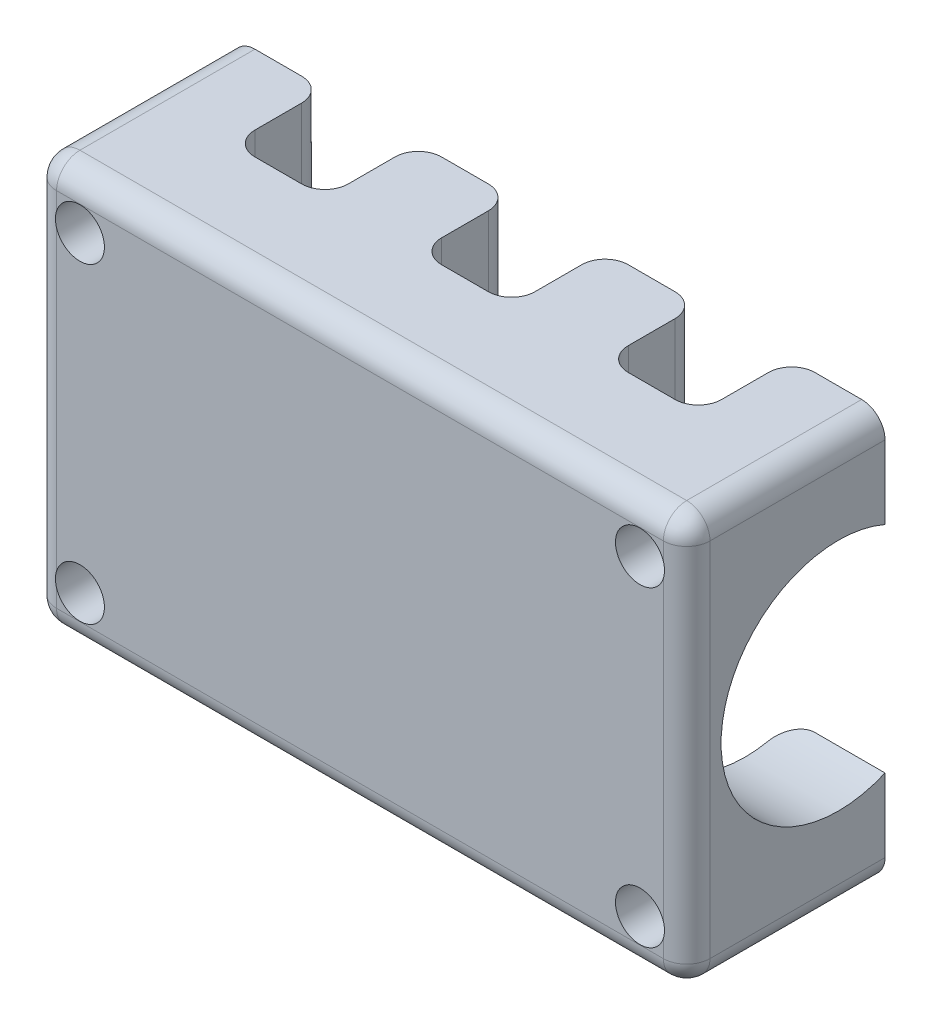
from build123d import *

# Parameters (mm, degrees)
SKETCH_1_W          = 56
SKETCH_1_H          = 35
EXTRUDE_1_DEPTH     = 26
SKETCH_2_R          = 10.05
CUT_EXTRUDE_1_DEPTH = 63
CUT_EXTRUDE_4_DEPTH = 41
SKETCH_6_R          = 2.1
CUT_EXTRUDE_5_DEPTH = 41
FILLET_2_R          = 2
FILLET_3_R          = 2


with BuildPart() as part:
    # 草图1 → 凸台-拉伸1 (new body)
    with BuildSketch(Plane.XY):
        with Locations((28, -17.5)):
            Rectangle(SKETCH_1_W, SKETCH_1_H)
    extrude(amount=EXTRUDE_1_DEPTH)

    # 草图2 → 切除-拉伸1 (cut)
    with BuildSketch(Plane.ZY):
        with Locations(Location((13, -17.5, 0), (0, 0, 270))):
            Circle(SKETCH_2_R)
    extrude(amount=-CUT_EXTRUDE_1_DEPTH, mode=Mode.SUBTRACT)

    # 草图3 → 切除-拉伸4 (cut)
    with BuildSketch(Plane(origin=(0, 0, 0), x_dir=(1, 0, 0), z_dir=(0, 1, 0))):
        Polygon((0, 0), (0, -9), (8, -9), (8, -17), (16, -17), (16, -9), (24, -9), (24, -17), (32, -17), (32, -9), (40, -9), (40, -17), (48, -17), (48, -9), (56, -9), (56, 0), align=None)
    extrude(amount=-CUT_EXTRUDE_4_DEPTH, mode=Mode.SUBTRACT)

    # 草图6 → 切除-拉伸5 (cut)
    with BuildSketch(Plane.XY.offset(26)):
        with Locations((4, -4.140159981)):
            Circle(SKETCH_6_R)
        with Locations((52, -4.140159981)):
            Circle(SKETCH_6_R)
        with Locations((52, -30.859840019)):
            Circle(SKETCH_6_R)
        with Locations((4, -30.859840019)):
            Circle(SKETCH_6_R)
    extrude(amount=-CUT_EXTRUDE_5_DEPTH, mode=Mode.SUBTRACT)

    # 圆角2
    # the kernel refuses this fillet: 2 mm, written as the material it adds along each edge
    with BuildSketch(Plane(origin=(48, -21.719680038, 17), x_dir=(-1, 0, 0), z_dir=(0, -1, 0))) as fillet_2_piece_1_section:
        with BuildLine():
            CenterArc((FILLET_2_R, FILLET_2_R), FILLET_2_R, 180, 90)
            Line((0, FILLET_2_R), (0, 0))
            Line((0, 0), (FILLET_2_R, 0))
        make_face()
    fillet_2_piece_1 = extrude(amount=13.280319962, mode=Mode.PRIVATE)
    fillet_2_piece_1 = fillet_2_piece_1 - Plane(origin=(47.542308917, -17.5, 13), x_dir=(0, -1, 0), z_dir=(-1, 0, 0)) * Cylinder(10.05, 35, mode=Mode.PRIVATE)
    add(fillet_2_piece_1)
    with BuildSketch(Plane(origin=(48, 0, 17), x_dir=(-1, 0, 0), z_dir=(0, -1, 0))) as fillet_2_piece_2_section:
        with BuildLine():
            CenterArc((FILLET_2_R, FILLET_2_R), FILLET_2_R, 180, 90)
            Line((0, FILLET_2_R), (0, 0))
            Line((0, 0), (FILLET_2_R, 0))
        make_face()
    fillet_2_piece_2 = extrude(amount=13.280319962, mode=Mode.PRIVATE)
    fillet_2_piece_2 = fillet_2_piece_2 - Plane(origin=(47.542307567, -17.5, 13), x_dir=(0, -1, 0), z_dir=(-1, 0, 0)) * Cylinder(10.05, 35, mode=Mode.PRIVATE)
    add(fillet_2_piece_2)
    with BuildSketch(Plane(origin=(40, -21.719680038, 17), x_dir=(0, 0, -1), z_dir=(0, -1, 0))) as fillet_2_piece_3_section:
        with BuildLine():
            CenterArc((FILLET_2_R, FILLET_2_R), FILLET_2_R, 180, 90)
            Line((0, FILLET_2_R), (0, 0))
            Line((0, 0), (FILLET_2_R, 0))
        make_face()
    fillet_2_piece_3 = extrude(amount=13.280319962, mode=Mode.PRIVATE)
    fillet_2_piece_3 = fillet_2_piece_3 - Plane(origin=(40.457691176, -17.5, 13), x_dir=(0, -1, 0), z_dir=(-1, 0, 0)) * Cylinder(10.05, 35, mode=Mode.PRIVATE)
    add(fillet_2_piece_3)
    with BuildSketch(Plane(origin=(40, 0, 17), x_dir=(0, 0, -1), z_dir=(0, -1, 0))) as fillet_2_piece_4_section:
        with BuildLine():
            CenterArc((FILLET_2_R, FILLET_2_R), FILLET_2_R, 180, 90)
            Line((0, FILLET_2_R), (0, 0))
            Line((0, 0), (FILLET_2_R, 0))
        make_face()
    fillet_2_piece_4 = extrude(amount=13.280319962, mode=Mode.PRIVATE)
    fillet_2_piece_4 = fillet_2_piece_4 - Plane(origin=(40.457692526, -17.5, 13), x_dir=(0, -1, 0), z_dir=(-1, 0, 0)) * Cylinder(10.05, 35, mode=Mode.PRIVATE)
    add(fillet_2_piece_4)
    with BuildSketch(Plane(origin=(32, -21.719680038, 17), x_dir=(-1, 0, 0), z_dir=(0, -1, 0))) as fillet_2_piece_5_section:
        with BuildLine():
            CenterArc((FILLET_2_R, FILLET_2_R), FILLET_2_R, 180, 90)
            Line((0, FILLET_2_R), (0, 0))
            Line((0, 0), (FILLET_2_R, 0))
        make_face()
    fillet_2_piece_5 = extrude(amount=13.280319962, mode=Mode.PRIVATE)
    fillet_2_piece_5 = fillet_2_piece_5 - Plane(origin=(31.542308917, -17.5, 13), x_dir=(0, -1, 0), z_dir=(-1, 0, 0)) * Cylinder(10.05, 35, mode=Mode.PRIVATE)
    add(fillet_2_piece_5)
    with BuildSketch(Plane(origin=(32, 0, 17), x_dir=(-1, 0, 0), z_dir=(0, -1, 0))) as fillet_2_piece_6_section:
        with BuildLine():
            CenterArc((FILLET_2_R, FILLET_2_R), FILLET_2_R, 180, 90)
            Line((0, FILLET_2_R), (0, 0))
            Line((0, 0), (FILLET_2_R, 0))
        make_face()
    fillet_2_piece_6 = extrude(amount=13.280319962, mode=Mode.PRIVATE)
    fillet_2_piece_6 = fillet_2_piece_6 - Plane(origin=(31.542307567, -17.5, 13), x_dir=(0, -1, 0), z_dir=(-1, 0, 0)) * Cylinder(10.05, 35, mode=Mode.PRIVATE)
    add(fillet_2_piece_6)
    with BuildSketch(Plane(origin=(24, -21.719680038, 17), x_dir=(0, 0, -1), z_dir=(0, -1, 0))) as fillet_2_piece_7_section:
        with BuildLine():
            CenterArc((FILLET_2_R, FILLET_2_R), FILLET_2_R, 180, 90)
            Line((0, FILLET_2_R), (0, 0))
            Line((0, 0), (FILLET_2_R, 0))
        make_face()
    fillet_2_piece_7 = extrude(amount=13.280319962, mode=Mode.PRIVATE)
    fillet_2_piece_7 = fillet_2_piece_7 - Plane(origin=(24.457691176, -17.5, 13), x_dir=(0, -1, 0), z_dir=(-1, 0, 0)) * Cylinder(10.05, 35, mode=Mode.PRIVATE)
    add(fillet_2_piece_7)
    with BuildSketch(Plane(origin=(24, 0, 17), x_dir=(0, 0, -1), z_dir=(0, -1, 0))) as fillet_2_piece_8_section:
        with BuildLine():
            CenterArc((FILLET_2_R, FILLET_2_R), FILLET_2_R, 180, 90)
            Line((0, FILLET_2_R), (0, 0))
            Line((0, 0), (FILLET_2_R, 0))
        make_face()
    fillet_2_piece_8 = extrude(amount=13.280319962, mode=Mode.PRIVATE)
    fillet_2_piece_8 = fillet_2_piece_8 - Plane(origin=(24.457692526, -17.5, 13), x_dir=(0, -1, 0), z_dir=(-1, 0, 0)) * Cylinder(10.05, 35, mode=Mode.PRIVATE)
    add(fillet_2_piece_8)
    with BuildSketch(Plane(origin=(16, -21.719680038, 17), x_dir=(-1, 0, 0), z_dir=(0, -1, 0))) as fillet_2_piece_9_section:
        with BuildLine():
            CenterArc((FILLET_2_R, FILLET_2_R), FILLET_2_R, 180, 90)
            Line((0, FILLET_2_R), (0, 0))
            Line((0, 0), (FILLET_2_R, 0))
        make_face()
    fillet_2_piece_9 = extrude(amount=13.280319962, mode=Mode.PRIVATE)
    fillet_2_piece_9 = fillet_2_piece_9 - Plane(origin=(15.542308917, -17.5, 13), x_dir=(0, -1, 0), z_dir=(-1, 0, 0)) * Cylinder(10.05, 35, mode=Mode.PRIVATE)
    add(fillet_2_piece_9)
    with BuildSketch(Plane(origin=(16, 0, 17), x_dir=(-1, 0, 0), z_dir=(0, -1, 0))) as fillet_2_piece_10_section:
        with BuildLine():
            CenterArc((FILLET_2_R, FILLET_2_R), FILLET_2_R, 180, 90)
            Line((0, FILLET_2_R), (0, 0))
            Line((0, 0), (FILLET_2_R, 0))
        make_face()
    fillet_2_piece_10 = extrude(amount=13.280319962, mode=Mode.PRIVATE)
    fillet_2_piece_10 = fillet_2_piece_10 - Plane(origin=(15.542307567, -17.5, 13), x_dir=(0, -1, 0), z_dir=(-1, 0, 0)) * Cylinder(10.05, 35, mode=Mode.PRIVATE)
    add(fillet_2_piece_10)
    with BuildSketch(Plane(origin=(8, -21.719680038, 17), x_dir=(0, 0, -1), z_dir=(0, -1, 0))) as fillet_2_piece_11_section:
        with BuildLine():
            CenterArc((FILLET_2_R, FILLET_2_R), FILLET_2_R, 180, 90)
            Line((0, FILLET_2_R), (0, 0))
            Line((0, 0), (FILLET_2_R, 0))
        make_face()
    fillet_2_piece_11 = extrude(amount=13.280319962, mode=Mode.PRIVATE)
    fillet_2_piece_11 = fillet_2_piece_11 - Plane(origin=(8.457691176, -17.5, 13), x_dir=(0, -1, 0), z_dir=(-1, 0, 0)) * Cylinder(10.05, 35, mode=Mode.PRIVATE)
    add(fillet_2_piece_11)
    with BuildSketch(Plane(origin=(8, 0, 17), x_dir=(0, 0, -1), z_dir=(0, -1, 0))) as fillet_2_piece_12_section:
        with BuildLine():
            CenterArc((FILLET_2_R, FILLET_2_R), FILLET_2_R, 180, 90)
            Line((0, FILLET_2_R), (0, 0))
            Line((0, 0), (FILLET_2_R, 0))
        make_face()
    fillet_2_piece_12 = extrude(amount=13.280319962, mode=Mode.PRIVATE)
    fillet_2_piece_12 = fillet_2_piece_12 - Plane(origin=(8.457692526, -17.5, 13), x_dir=(0, -1, 0), z_dir=(-1, 0, 0)) * Cylinder(10.05, 35, mode=Mode.PRIVATE)
    add(fillet_2_piece_12)
    # the kernel refuses this fillet: 2 mm, written as the material it takes off along each edge
    with BuildSketch(Plane(origin=(48, -21.719680038, 9), x_dir=(1, 0, 0), z_dir=(0, -1, 0))) as fillet_2_2_piece_1:
        with BuildLine():
            CenterArc((FILLET_2_R, FILLET_2_R), FILLET_2_R, 180, 90)
            Line((0, FILLET_2_R), (0, 0))
            Line((0, 0), (FILLET_2_R, 0))
        make_face()
    extrude(amount=18.280319962, mode=Mode.SUBTRACT)
    with BuildSketch(Plane(origin=(48, 5, 9), x_dir=(0, 0, 1), z_dir=(0, -1, 0)), Plane(origin=(40, -21.719680038, 9), x_dir=(-1, 0, 0), z_dir=(0, -1, 0)), Plane(origin=(40, 5, 9), x_dir=(-1, 0, 0), z_dir=(0, -1, 0)), Plane(origin=(32, -21.719680038, 9), x_dir=(0, 0, 1), z_dir=(0, -1, 0)), Plane(origin=(32, 5, 9), x_dir=(0, 0, 1), z_dir=(0, -1, 0)), Plane(origin=(24, -21.719680038, 9), x_dir=(-1, 0, 0), z_dir=(0, -1, 0)), Plane(origin=(24, 5, 9), x_dir=(-1, 0, 0), z_dir=(0, -1, 0)), Plane(origin=(16, -21.719680038, 9), x_dir=(0, 0, 1), z_dir=(0, -1, 0)), Plane(origin=(16, 5, 9), x_dir=(0, 0, 1), z_dir=(0, -1, 0)), Plane(origin=(8, -21.719680038, 9), x_dir=(-1, 0, 0), z_dir=(0, -1, 0)), Plane(origin=(8, 5, 9), x_dir=(-1, 0, 0), z_dir=(0, -1, 0))) as fillet_2_2_piece_2:
        with BuildLine():
            CenterArc((FILLET_2_R, -FILLET_2_R), FILLET_2_R, 90, 90)
            Line((0, -FILLET_2_R), (0, 0))
            Line((0, 0), (FILLET_2_R, 0))
        make_face()
    extrude(amount=18.280319962, mode=Mode.SUBTRACT)

    # 圆角3
    # the kernel refuses this fillet: 2 mm, written as the material it takes off along each edge
    with BuildSketch(Plane(origin=(2, -2, 24), x_dir=(0, 0, 1), z_dir=(0, 1, 0))) as fillet_3_piece_1_section:
        Polygon((0, 0), (FILLET_3_R, 0), (FILLET_3_R, -FILLET_3_R), (0, -FILLET_3_R), align=None)
    fillet_3_piece_1 = extrude(amount=FILLET_3_R, mode=Mode.PRIVATE)
    fillet_3_piece_1 = fillet_3_piece_1 - Plane(origin=(2, -2, 24), x_dir=(0.7071067811865475, 0, -0.7071067811865475), z_dir=(0, 1, 0)) * Sphere(FILLET_3_R, mode=Mode.PRIVATE)
    add(fillet_3_piece_1, mode=Mode.SUBTRACT)
    with BuildSketch(Plane(origin=(54, -2, 24), x_dir=(0, 0, 1), z_dir=(0, 1, 0))) as fillet_3_piece_2_section:
        Polygon((0, 0), (FILLET_3_R, 0), (FILLET_3_R, FILLET_3_R), (0, FILLET_3_R), align=None)
    fillet_3_piece_2 = extrude(amount=FILLET_3_R, mode=Mode.PRIVATE)
    fillet_3_piece_2 = fillet_3_piece_2 - Plane(origin=(54, -2, 24), x_dir=(-0.7071067811865475, 0, -0.7071067811865475), z_dir=(0, 1, 0)) * Sphere(FILLET_3_R, mode=Mode.PRIVATE)
    add(fillet_3_piece_2, mode=Mode.SUBTRACT)
    with BuildSketch(Plane(origin=(2, -33, 24), x_dir=(0, 0, 1), z_dir=(0, -1, 0))) as fillet_3_piece_3_section:
        Polygon((0, 0), (FILLET_3_R, 0), (FILLET_3_R, FILLET_3_R), (0, FILLET_3_R), align=None)
    fillet_3_piece_3 = extrude(amount=FILLET_3_R, mode=Mode.PRIVATE)
    fillet_3_piece_3 = fillet_3_piece_3 - Plane(origin=(2, -33, 24), x_dir=(0.7071067811865475, 0, -0.7071067811865475), z_dir=(0, -1, 0)) * Sphere(FILLET_3_R, mode=Mode.PRIVATE)
    add(fillet_3_piece_3, mode=Mode.SUBTRACT)
    with BuildSketch(Plane(origin=(54, -33, 24), x_dir=(1, 0, 0), z_dir=(0, -1, 0))) as fillet_3_piece_4_section:
        Polygon((0, 0), (FILLET_3_R, 0), (FILLET_3_R, FILLET_3_R), (0, FILLET_3_R), align=None)
    fillet_3_piece_4 = extrude(amount=FILLET_3_R, mode=Mode.PRIVATE)
    fillet_3_piece_4 = fillet_3_piece_4 - Plane(origin=(54, -33, 24), x_dir=(-0.7071067811865475, 0, -0.7071067811865475), z_dir=(0, -1, 0)) * Sphere(FILLET_3_R, mode=Mode.PRIVATE)
    add(fillet_3_piece_4, mode=Mode.SUBTRACT)
    with BuildSketch(Plane(origin=(2, 0, 26), x_dir=(0, 0, -1), z_dir=(1, 0, 0))) as fillet_3_piece_5:
        with BuildLine():
            CenterArc((FILLET_3_R, -FILLET_3_R), FILLET_3_R, 90, 90)
            Line((0, -FILLET_3_R), (0, 0))
            Line((0, 0), (FILLET_3_R, 0))
        make_face()
    extrude(amount=52, mode=Mode.SUBTRACT)
    with BuildSketch(Plane(origin=(0, -33, 26), x_dir=(1, 0, 0), z_dir=(0, 1, 0))) as fillet_3_piece_6:
        with BuildLine():
            CenterArc((FILLET_3_R, FILLET_3_R), FILLET_3_R, 180, 90)
            Line((0, FILLET_3_R), (0, 0))
            Line((0, 0), (FILLET_3_R, 0))
        make_face()
    extrude(amount=31, mode=Mode.SUBTRACT)
    with BuildSketch(Plane(origin=(54, -35, 26), x_dir=(0, 1, 0), z_dir=(-1, 0, 0))) as fillet_3_piece_7:
        with BuildLine():
            CenterArc((FILLET_3_R, FILLET_3_R), FILLET_3_R, 180, 90)
            Line((0, FILLET_3_R), (0, 0))
            Line((0, 0), (FILLET_3_R, 0))
        make_face()
    extrude(amount=52, mode=Mode.SUBTRACT)
    with BuildSketch(Plane(origin=(0, -35, 4), x_dir=(0, 1, 0), z_dir=(0, 0, 1)), Plane(origin=(0, 0, 4), x_dir=(1, 0, 0), z_dir=(0, 0, 1))) as fillet_3_piece_8:
        with BuildLine():
            CenterArc((FILLET_3_R, -FILLET_3_R), FILLET_3_R, 90, 90)
            Line((0, -FILLET_3_R), (0, 0))
            Line((0, 0), (FILLET_3_R, 0))
        make_face()
    extrude(amount=20, mode=Mode.SUBTRACT)
    with BuildSketch(Plane(origin=(56, 0, 4), x_dir=(-1, 0, 0), z_dir=(0, 0, 1)), Plane(origin=(56, -35, 4), x_dir=(0, 1, 0), z_dir=(0, 0, 1))) as fillet_3_piece_9:
        with BuildLine():
            CenterArc((FILLET_3_R, FILLET_3_R), FILLET_3_R, 180, 90)
            Line((0, FILLET_3_R), (0, 0))
            Line((0, 0), (FILLET_3_R, 0))
        make_face()
    extrude(amount=20, mode=Mode.SUBTRACT)
    with BuildSketch(Plane(origin=(56, -2, 26), x_dir=(0, 0, -1), z_dir=(0, -1, 0))) as fillet_3_piece_10:
        with BuildLine():
            CenterArc((FILLET_3_R, -FILLET_3_R), FILLET_3_R, 90, 90)
            Line((0, -FILLET_3_R), (0, 0))
            Line((0, 0), (FILLET_3_R, 0))
        make_face()
    extrude(amount=31, mode=Mode.SUBTRACT)


solid = part.part
